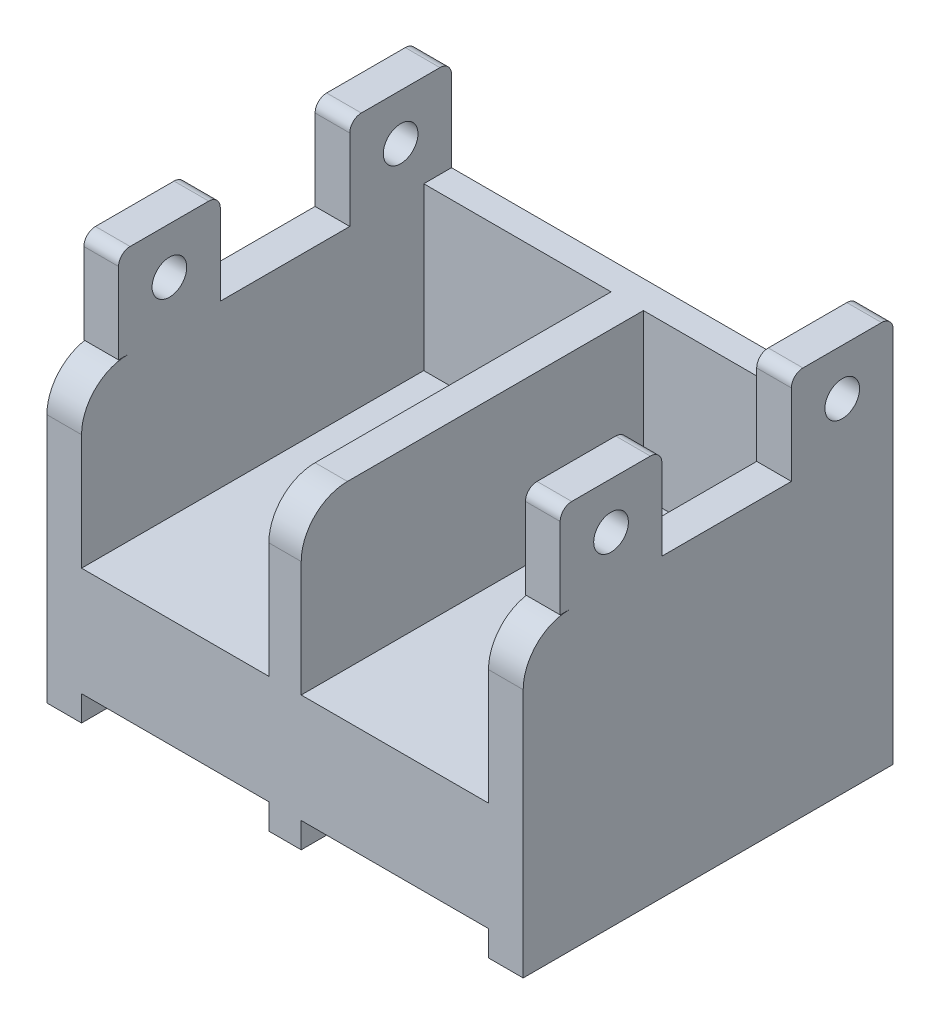
from build123d import *

# Parameters (mm, degrees)
SKETCH1_W                 = 20.6
SKETCH1_H                 = 16
BOSS_EXTRUDE1_DEPTH       = 12.8
SKETCH2_W                 = 8.1
SKETCH2_H                 = 16
BOTTOM_CUT_DEPTH          = 1.1
FILL_PATTERN1_OUTLINE_W   = 8.1
FILL_PATTERN1_OUTLINE_H   = 16
FILL_PATTERN1_DEPTH       = 1.1
FILLET1_R                 = 2
SKETCH3_W                 = 8.1
SKETCH3_H                 = 14.8
TOP_CUT_DEPTH             = 7
M3X0_5_TAPPED_HOLE1_D     = 2.5
FILL_START                = 5.8
FILL_PATTERN2_OUTLINE_W   = 8.1
FILL_PATTERN2_OUTLINE_H   = 14.8
FILL_PATTERN2_DEPTH       = 7
FILL_START_2              = 1.1
FILL_PATTERN2_2_OUTLINE_R = 1.25
FILL_PATTERN2_2_DEPTH     = 4.7
SKETCH7_W                 = 1.5
SKETCH7_H                 = 4.4
BOSS_EXTRUDE2_DEPTH       = 4
CUT_EXTRUDE1_REACH        = 29.76
SKETCH8_R                 = 0.75
FILLET2_R                 = 0.5
LPATTERN1_COUNT           = 2
LPATTERN1_PITCH           = 10
FILLET2_OF_LPATTERN1_R    = 0.5
MIRROR1_START             = 8.8
MIRROR1_OUTLINE_R         = 0.75
MIRROR1_DEPTH             = 1.5


# Read off the part's stored shape, not the designer's step: Fill Pattern1, Fill Pattern2, Mirror1
with BuildPart() as part:
    # Sketch1 → Boss-Extrude1 (new body)
    with BuildSketch(Plane(origin=(0, 0, 0), x_dir=(1, 0, 0), z_dir=(0, 1, 0))):
        Rectangle(SKETCH1_W, SKETCH1_H)
    extrude(amount=BOSS_EXTRUDE1_DEPTH)

    # Sketch2 → BOTTOM CUT (cut)
    with BuildSketch(Plane.XZ):
        with Locations((-4.75, 0)):
            Rectangle(SKETCH2_W, SKETCH2_H)
    extrude(amount=-BOTTOM_CUT_DEPTH, mode=Mode.SUBTRACT)

    # Fill Pattern1 outline → Fill Pattern1 (cut)
    with BuildSketch(Plane(origin=(0, 0, 0), x_dir=(1, 0, 0), z_dir=(0, 1, 0))):
        with Locations((4.75, 0)):
            Rectangle(FILL_PATTERN1_OUTLINE_W, FILL_PATTERN1_OUTLINE_H)
    extrude(amount=FILL_PATTERN1_DEPTH, mode=Mode.SUBTRACT)

    # Fillet1
    fillet1_edges = [part.edges().sort_by_distance(p)[0] for p in [
        (0, 12.8, 8),
    ]]
    fillet(fillet1_edges, radius=FILLET1_R)

    # Sketch3 → TOP CUT (cut)
    with BuildSketch(Plane(origin=(0, 12.8, 0), x_dir=(1, 0, 0), z_dir=(0, 1, 0))):
        with Locations((-4.75, -0.6)):
            Rectangle(SKETCH3_W, SKETCH3_H)
    extrude(amount=-TOP_CUT_DEPTH, mode=Mode.SUBTRACT)

    # M3x0.5 Tapped Hole1 (through all)
    with Locations(Plane(origin=(0, 5.8, 0), x_dir=(1, 0, 0), z_dir=(0, 1, 0))):
        with Locations((-4.75, -1)):
            Hole(M3X0_5_TAPPED_HOLE1_D / 2)

    # Fill Pattern2 outline → Fill Pattern2 (cut)
    with BuildSketch(Plane(origin=(0, 0, 0), x_dir=(1, 0, 0), z_dir=(0, 1, 0)).offset(FILL_START)):
        with Locations((4.75, -0.6)):
            Rectangle(FILL_PATTERN2_OUTLINE_W, FILL_PATTERN2_OUTLINE_H)
    extrude(amount=FILL_PATTERN2_DEPTH, mode=Mode.SUBTRACT)

    # Fill Pattern2 2 outline → Fill Pattern2 2 (cut)
    with BuildSketch(Plane(origin=(0, 0, 0), x_dir=(1, 0, 0), z_dir=(0, 1, 0)).offset(FILL_START_2)):
        with Locations((4.75, -1)):
            Circle(FILL_PATTERN2_2_OUTLINE_R)
    extrude(amount=FILL_PATTERN2_2_DEPTH, mode=Mode.SUBTRACT)

    # Sketch7 → Boss-Extrude2 (add)
    with BuildSketch(Plane(origin=(0, 12.8, 0), x_dir=(1, 0, 0), z_dir=(0, 1, 0))):
        with Locations((-9.55, 5.8)):
            Rectangle(SKETCH7_W, SKETCH7_H)
    boss_extrude2 = extrude(amount=BOSS_EXTRUDE2_DEPTH)

    # Sketch8 → Cut-Extrude1 (cut, up to next)
    with BuildSketch(Plane.ZY.offset(10.3), mode=Mode.PRIVATE) as cut_extrude1_sk1:
        with Locations((-5.8, 14.8)):
            Circle(SKETCH8_R)
    cut_extrude1_tool1 = extrude(cut_extrude1_sk1.sketch, amount=-CUT_EXTRUDE1_REACH, mode=Mode.PRIVATE) & part.part
    cut_extrude1 = cut_extrude1_tool1.solids().sort_by_distance((-10.3, 14.8, -5.8))[0]
    add(cut_extrude1, mode=Mode.SUBTRACT)

    # Fillet2
    fillet2_edges = [part.edges().sort_by_distance(p)[0] for p in [
        (-9.55, 16.8, -3.6),
        (-9.55, 16.8, -8),
    ]]
    fillet(fillet2_edges, radius=FILLET2_R)

    # LPattern1: Boss-Extrude2, Cut-Extrude1 ×2
    with Locations(*[(0, 0, i * LPATTERN1_PITCH) for i in range(1, LPATTERN1_COUNT)]):
        add(boss_extrude2)
        add(cut_extrude1, mode=Mode.SUBTRACT)

    # Fillet2 of LPattern1
    fillet2_of_lpattern1_edges = [part.edges().sort_by_distance(p)[0] for p in [
        (-9.55, 16.8, 6.4),
        (-9.55, 16.8, 2),
    ]]
    fillet(fillet2_of_lpattern1_edges, radius=FILLET2_OF_LPATTERN1_R)

    # Mirror1 outline → Mirror1 (add)
    # profile 1 of 2: a face of its own
    with BuildSketch(Plane.YZ.offset(MIRROR1_START)):
        with BuildLine():
            ThreePointArc((16.8, -4.1), (16.653553391, -3.746446609), (16.3, -3.6))
            Line((16.3, -3.6), (12.8, -3.6))
            Line((12.8, -3.6), (12.8, -8))
            Line((12.8, -8), (16.3, -8))
            ThreePointArc((16.3, -8), (16.653553391, -7.853553391), (16.8, -7.5))
            Line((16.8, -7.5), (16.8, -4.1))
        make_face()
        with Locations((14.8, -5.8)):
            Circle(MIRROR1_OUTLINE_R, mode=Mode.SUBTRACT)
    # profile 2 of 2: a face of its own
    with BuildSketch(Plane.YZ.offset(MIRROR1_START)):
        with BuildLine():
            Line((12.8, 6.4), (12.8, 2))
            Line((12.8, 2), (16.3, 2))
            ThreePointArc((16.3, 2), (16.653553391, 2.146446609), (16.8, 2.5))
            Line((16.8, 2.5), (16.8, 5.9))
            ThreePointArc((16.8, 5.9), (16.653553391, 6.253553391), (16.3, 6.4))
            Line((16.3, 6.4), (12.8, 6.4))
        make_face()
        with Locations((14.8, 4.2)):
            Circle(MIRROR1_OUTLINE_R, mode=Mode.SUBTRACT)
    extrude(amount=MIRROR1_DEPTH)


solid = part.part
